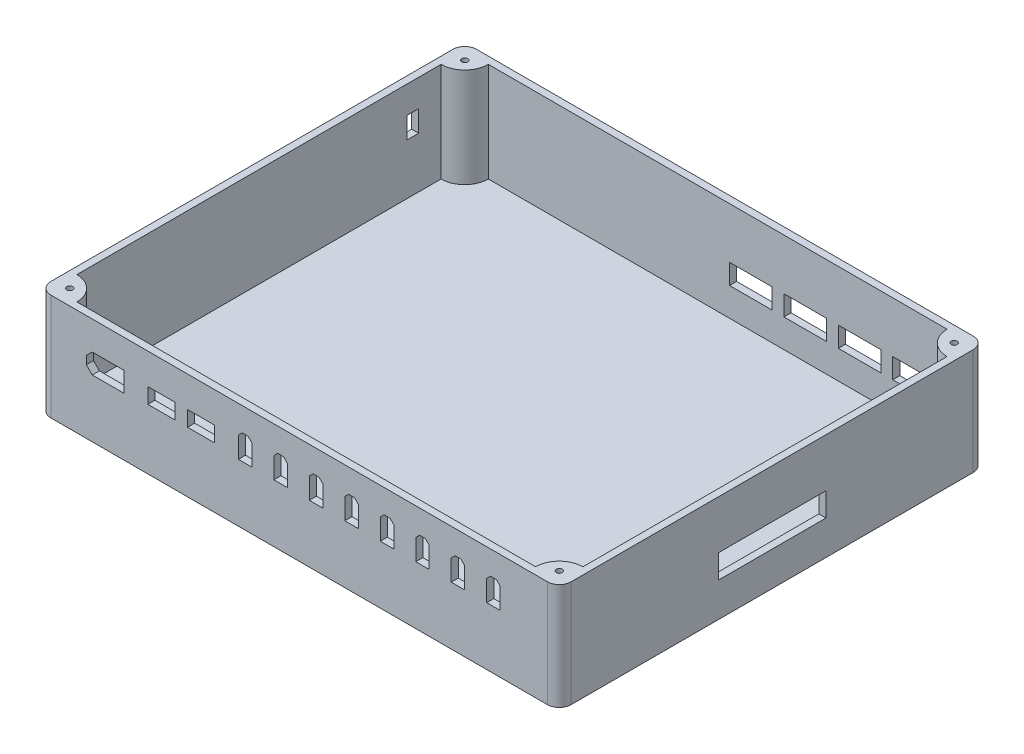
from build123d import *

# Parameters (mm, degrees)
SKETCH1_W           = 220
SKETCH1_H           = 180
BOSS_EXTRUDE1_DEPTH = 45
FILLET1_R           = 5
CUT_EXTRUDE7_DEPTH  = 42
CUT_EXTRUDE2_DEPTH  = 5
CUT_EXTRUDE3_DEPTH  = 5
SKETCH4_W           = 11.5
SKETCH4_H           = 6.5
CUT_EXTRUDE4_DEPTH  = 5
SKETCH5_W           = 45.536818034
SKETCH5_H           = 10
CUT_EXTRUDE5_DEPTH  = 5
SKETCH6_W           = 18
SKETCH6_H           = 8.5
CUT_EXTRUDE6_DEPTH  = 5
SKETCH8_W           = 5
SKETCH8_H           = 9
CUT_EXTRUDE8_DEPTH  = 4.2
SKETCH10_R          = 1.25
CUT_EXTRUDE9_DEPTH  = 40


with BuildPart() as part:
    # Sketch1 → Boss-Extrude1 (new body)
    with BuildSketch(Plane(origin=(0, 0, 0), x_dir=(1, 0, 0), z_dir=(0, 1, 0))):
        with Locations((110, 90)):
            Rectangle(SKETCH1_W, SKETCH1_H)
    extrude(amount=BOSS_EXTRUDE1_DEPTH)

    # Fillet1
    fillet1_edges = [part.edges().sort_by_distance(p)[0] for p in [
        (0, 22.5, -180),
        (0, 22.5, 0),
        (220, 22.5, -180),
        (220, 22.5, 0),
    ]]
    fillet(fillet1_edges, radius=FILLET1_R)

    # Sketch7 → Cut-Extrude7 (cut)
    with BuildSketch(Plane(origin=(0, 45, 0), x_dir=(1, 0, 0), z_dir=(0, 1, 0))):
        with BuildLine():
            Line((207, 177), (13, 177))
            ThreePointArc((13, 177), (10.071067812, 169.928932188), (3, 167))
            Line((3, 167), (3, 13))
            ThreePointArc((3, 13), (10.071067812, 10.071067812), (13, 3))
            Line((13, 3), (207, 3))
            ThreePointArc((207, 3), (209.928932188, 10.071067812), (217, 13))
            Line((217, 13), (217, 167))
            ThreePointArc((217, 167), (209.928932188, 169.928932188), (207, 177))
        make_face()
    extrude(amount=-CUT_EXTRUDE7_DEPTH, mode=Mode.SUBTRACT)

    # Sketch2 → Cut-Extrude2 (cut)
    with BuildSketch(Plane.XY):
        Polygon((175.9, 35), (178.4, 35), (180, 33.4), (180, 24.5), (174.3, 24.5), (174.3, 33.4), align=None)
        Polygon((190.9, 35), (193.4, 35), (195, 33.4), (195, 24.5), (189.3, 24.5), (189.3, 33.4), align=None)
        Polygon((160.9, 35), (163.4, 35), (165, 33.4), (165, 24.5), (159.3, 24.5), (159.3, 33.4), align=None)
        Polygon((145.9, 35), (148.4, 35), (150, 33.4), (150, 24.5), (144.3, 24.5), (144.3, 33.4), align=None)
        Polygon((130.9, 35), (133.4, 35), (135, 33.4), (135, 24.5), (129.3, 24.5), (129.3, 33.4), align=None)
        Polygon((115.9, 35), (118.4, 35), (120, 33.4), (120, 24.5), (114.3, 24.5), (114.3, 33.4), align=None)
        Polygon((100.9, 35), (103.4, 35), (105, 33.4), (105, 24.5), (99.3, 24.5), (99.3, 33.4), align=None)
        Polygon((85.9, 35), (88.4, 35), (90, 33.4), (90, 24.5), (84.3, 24.5), (84.3, 33.4), align=None)
    extrude(amount=-CUT_EXTRUDE2_DEPTH, mode=Mode.SUBTRACT)

    # Sketch3 → Cut-Extrude3 (cut)
    with BuildSketch(Plane.XY):
        Polygon((22.5, 32.9), (36, 32.9), (36, 24.5), (22.5, 24.5), (20, 27), (20, 30.4), align=None)
    extrude(amount=-CUT_EXTRUDE3_DEPTH, mode=Mode.SUBTRACT)

    # Sketch4 → Cut-Extrude4 (cut)
    with BuildSketch(Plane.XY):
        with Locations((51.75, 28.75)):
            Rectangle(SKETCH4_W, SKETCH4_H)
        with Locations((68.55, 28.75)):
            Rectangle(SKETCH4_W, SKETCH4_H)
    extrude(amount=-CUT_EXTRUDE4_DEPTH, mode=Mode.SUBTRACT)

    # Sketch5 → Cut-Extrude5 (cut)
    with BuildSketch(Plane(origin=(220, 0, 0), x_dir=(0, 0, -1), z_dir=(1, 0, 0))):
        with Locations((90, 19.480228536)):
            Rectangle(SKETCH5_W, SKETCH5_H)
    extrude(amount=-CUT_EXTRUDE5_DEPTH, mode=Mode.SUBTRACT)

    # Sketch6 → Cut-Extrude6 (cut)
    with BuildSketch(Plane(origin=(0, 0, -180), x_dir=(-1, 0, 0), z_dir=(0, 0, -1))):
        with Locations((-193, 19.25)):
            Rectangle(SKETCH6_W, SKETCH6_H)
        with Locations((-170, 19.25)):
            Rectangle(SKETCH6_W, SKETCH6_H)
        with Locations((-147, 19.25)):
            Rectangle(SKETCH6_W, SKETCH6_H)
        with Locations((-124, 19.25)):
            Rectangle(SKETCH6_W, SKETCH6_H)
    extrude(amount=-CUT_EXTRUDE6_DEPTH, mode=Mode.SUBTRACT)

    # Sketch8 → Cut-Extrude8 (cut)
    with BuildSketch(Plane.ZY):
        with Locations((-155.038386618, 29)):
            Rectangle(SKETCH8_W, SKETCH8_H)
    extrude(amount=-CUT_EXTRUDE8_DEPTH, mode=Mode.SUBTRACT)

    # Sketch10 → Cut-Extrude9 (cut)
    with BuildSketch(Plane(origin=(0, 45, 0), x_dir=(1, 0, 0), z_dir=(0, 1, 0))):
        with Locations((6.5, 173.5)):
            Circle(SKETCH10_R)
        with Locations((213.5, 173.5)):
            Circle(SKETCH10_R)
        with Locations((213.5, 6.5)):
            Circle(SKETCH10_R)
        with Locations((6.5, 6.5)):
            Circle(SKETCH10_R)
    extrude(amount=-CUT_EXTRUDE9_DEPTH, mode=Mode.SUBTRACT)


solid = part.part
